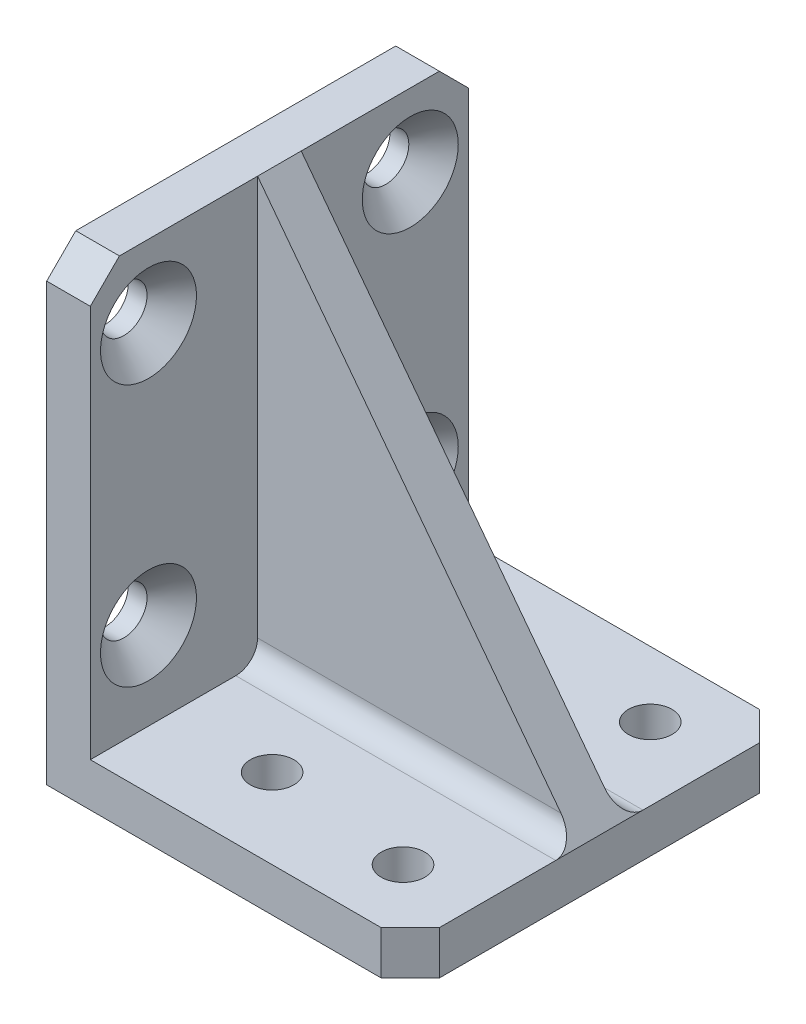
from build123d import *

# Parameters (mm, degrees)
EXTRUDE_1_DEPTH          = 13
SKETCH_4_R               = 1.5
CUT_EXTRUDE_1_DEPTH      = 3
EXTRUDE_2_DEPTH          = 1.5
CHAMFER_1_SIZE           = 2
FILLET_1_R               = 1.5
HOLE_WIZARD_1_AT_2_COUNT = 2
HOLE_WIZARD_1_AT_2_PITCH = 18
HOLE_WIZARD_1_AT_3_COUNT = 2
HOLE_WIZARD_1_AT_3_PITCH = 25.455844123
HOLE_WIZARD_1_AT_4_COUNT = 2
HOLE_WIZARD_1_AT_4_PITCH = 18


with BuildPart() as part:
    # 草图1 → 凸台-拉伸1 (new, symmetric)
    with BuildSketch(Plane.XY):
        Polygon((0, 0), (25, 0), (25, 3), (3, 3), (3, 32), (0, 32), align=None)
    extrude(amount=EXTRUDE_1_DEPTH, both=True)

    # 草图4 → 切除-拉伸1 (cut)
    with BuildSketch(Plane.XZ):
        with Locations(Location((10, -7.5, 0), (0, 0, 270))):
            Circle(SKETCH_4_R)
        with Locations(Location((10, 7.5, 0), (0, 0, 270))):
            Circle(SKETCH_4_R)
        with Locations(Location((20, 8.5, 0), (0, 0, 270))):
            Circle(SKETCH_4_R)
        with Locations(Location((20, -8.5, 0), (0, 0, 270))):
            Circle(SKETCH_4_R)
    extrude(amount=-CUT_EXTRUDE_1_DEPTH, mode=Mode.SUBTRACT)

    # 草图2 → 凸台-拉伸2 (add, symmetric)
    with BuildSketch(Plane.XY):
        Polygon((3, 32), (3, 3), (25, 3), align=None)
    extrude(amount=EXTRUDE_2_DEPTH, both=True)

    # 倒角1
    chamfer_1_edges = [part.edges().sort_by_distance(p)[0] for p in [
        (25, 1.5, 13),
        (1.5, 32, 13),
        (1.5, 32, -13),
        (25, 1.5, -13),
    ]]
    chamfer(chamfer_1_edges, length=CHAMFER_1_SIZE)

    # 圆角1
    # the kernel refuses this fillet: 1.5 mm, written as the material it adds along each edge
    with BuildSketch(Plane(origin=(3, 3, -1.5), x_dir=(0, 0, -1), z_dir=(1, 0, 0))) as fillet_1_piece_1_section:
        with BuildLine():
            CenterArc((FILLET_1_R, FILLET_1_R), FILLET_1_R, 180, 90)
            Line((0, FILLET_1_R), (0, 0))
            Line((0, 0), (FILLET_1_R, 0))
        make_face()
    fillet_1_piece_1 = extrude(amount=25.75, mode=Mode.PRIVATE)
    fillet_1_piece_1 = split(fillet_1_piece_1, bisect_by=Plane(origin=(20.775844012, 8.568205621, -1.836675405), z_dir=(-0.7966912709023963, -0.6043864813742318, 0)), keep=Keep.TOP, mode=Mode.PRIVATE)
    add(fillet_1_piece_1)
    with BuildSketch(Plane(origin=(3, 3, 1.5), x_dir=(0, 0, 1), z_dir=(1, 0, 0))) as fillet_1_piece_2_section:
        with BuildLine():
            CenterArc((FILLET_1_R, -FILLET_1_R), FILLET_1_R, 90, 90)
            Line((0, -FILLET_1_R), (0, 0))
            Line((0, 0), (FILLET_1_R, 0))
        make_face()
    fillet_1_piece_2 = extrude(amount=25.75, mode=Mode.PRIVATE)
    fillet_1_piece_2 = split(fillet_1_piece_2, bisect_by=Plane(origin=(20.775844012, 8.568205621, 1.836675405), z_dir=(-0.7966912709023963, -0.6043864813742318, 0)), keep=Keep.TOP, mode=Mode.PRIVATE)
    add(fillet_1_piece_2)

    # 草图6 → 打孔尺寸(%根据)开槽半沉头木螺钉的类型1 (revolve, cut)
    with BuildSketch(Plane(origin=(3, 9, -9), x_dir=(0, 0, -1), z_dir=(0, 1, 0))):
        Polygon((0, 0), (0, 3), (1.6, 3), (1.6, 1.7), (3.3, 0), align=None)
    hole_wizard_1 = revolve(axis=Axis((9.35, 9, -9), (-1, 0, 0)), mode=Mode.SUBTRACT)

    # 打孔尺寸(%根据)开槽半沉头木螺钉的类型1 at 2: 打孔尺寸(%根据)开槽半沉头木螺钉的类型1 ×2
    with Locations(*[(0, 0, i * HOLE_WIZARD_1_AT_2_PITCH) for i in range(1, HOLE_WIZARD_1_AT_2_COUNT)]):
        add(hole_wizard_1, mode=Mode.SUBTRACT)

    # 打孔尺寸(%根据)开槽半沉头木螺钉的类型1 at 3: 打孔尺寸(%根据)开槽半沉头木螺钉的类型1 ×2
    with Locations(*[Vector(0, 0.7071067811865476, 0.7071067811865476) * (i * HOLE_WIZARD_1_AT_3_PITCH) for i in range(1, HOLE_WIZARD_1_AT_3_COUNT)]):
        add(hole_wizard_1, mode=Mode.SUBTRACT)

    # 打孔尺寸(%根据)开槽半沉头木螺钉的类型1 at 4: 打孔尺寸(%根据)开槽半沉头木螺钉的类型1 ×2
    with Locations(*[(0, i * HOLE_WIZARD_1_AT_4_PITCH, 0) for i in range(1, HOLE_WIZARD_1_AT_4_COUNT)]):
        add(hole_wizard_1, mode=Mode.SUBTRACT)


solid = part.part
